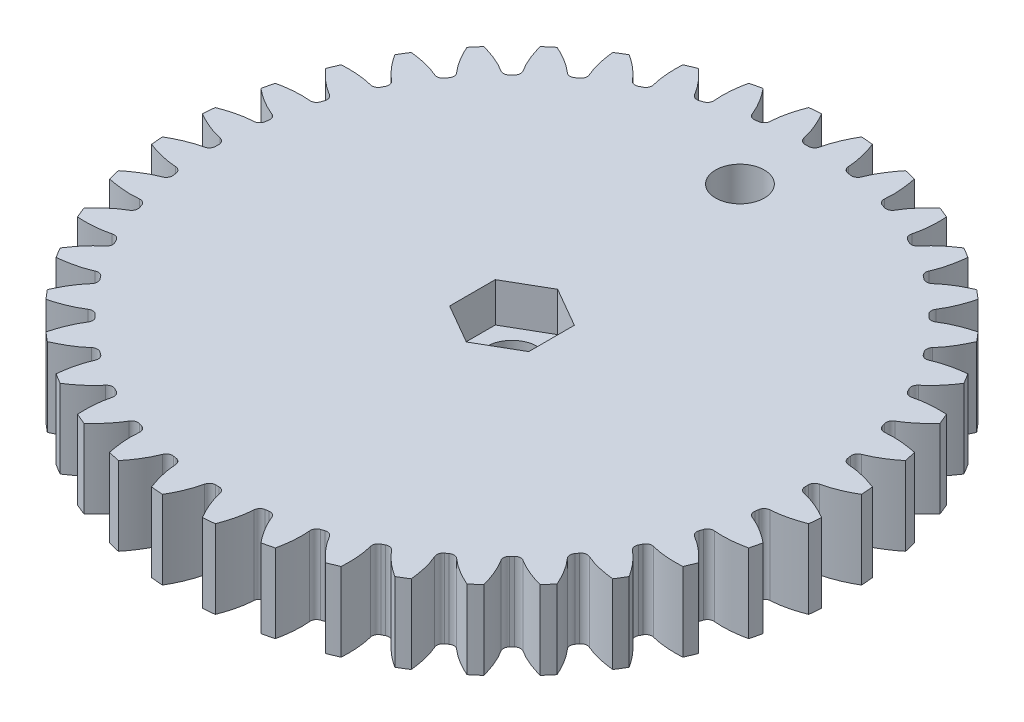
from build123d import *

# Parameters (mm, degrees)
SKETCH2_R                = 53.34
BOSS_EXTRUDE1_DEPTH      = 12.7
CUT_EXTRUDE1_DEPTH       = 12.7
FILLET2_R                = 1.016
CIRPATTERN1_COUNT        = 40
FILLET2_OF_CIRPATTERN1_R = 1.016
SKETCH4_R                = 4.09575
CUT_EXTRUDE2_DEPTH       = 77.359986682
CUT_EXTRUDE3_DEPTH       = 6.35
CUT_EXTRUDE4_DEPTH       = 77.359986682
CUT_EXTRUDE4_DEPTH_BACK  = 77.359986682
SKETCH6_R                = 3.937


with BuildPart() as part:
    # Sketch2 → Boss-Extrude1 (new body)
    with BuildSketch(Plane(origin=(0, 0, 0), x_dir=(1, 0, 0), z_dir=(0, 1, 0))):
        Circle(SKETCH2_R)
    extrude(amount=BOSS_EXTRUDE1_DEPTH)

    # Sketch3 → Cut-Extrude1 (cut)
    with BuildSketch(Plane(origin=(0, 0, 0), x_dir=(-1, 0, 0), z_dir=(0, -1, 0))):
        with BuildLine():
            Line((47.610863724, -1.16029328), (47.722215798, -1.163006969))
            add(Edge.make_bspline(
                [(47.722215798, -1.163006969), (47.730982789, -1.163313167), (47.755564012, -1.16445845), (47.802003051, -1.167754997), (47.87772523, -1.174741096), (47.974119041, -1.186004909), (48.098593622, -1.203276497), (48.245061479, -1.227112329), (48.405834144, -1.256963367), (48.580520514, -1.293386204), (48.754577285, -1.333212779), (48.927987969, -1.376189951), (49.100522746, -1.421931459), (49.30925176, -1.48080125), (49.559155717, -1.556203831), (49.850651678, -1.651349023), (50.180503564, -1.767531099), (50.515821541, -1.894787282), (50.845048793, -2.027276114), (51.176798745, -2.169495413), (51.497150175, -2.313020498), (51.828924093, -2.470658837), (52.134675109, -2.620519189), (52.476090794, -2.797888155), (52.751288045, -2.94379105), (53.034579939, -3.102405155), (53.172312998, -3.180768911), (53.242640535, -3.221308569)],
                knots=[0, 0, 0, 0, 0, 0.005376749, 0.015083688, 0.02853182, 0.04661014, 0.064854849, 0.092110526, 0.119476176, 0.146842496, 0.174208854, 0.201574956, 0.228941013, 0.256307345, 0.307035032, 0.361767352, 0.416499661, 0.471231937, 0.525964282, 0.580696616, 0.635428982, 0.690161387, 0.744893688, 0.799626082, 0.854358407, 0.909090914, 0.909090914, 0.909090914, 0.909090914, 0.909090914], degree=4))
            ThreePointArc((53.242640535, -3.221308569), (53.34, 0), (53.242640535, 3.221308569))
            add(Edge.make_bspline(
                [(53.242640535, 3.221308569), (53.172312998, 3.180768911), (53.034579939, 3.102405155), (52.751288045, 2.94379105), (52.476090794, 2.797888155), (52.134675109, 2.620519189), (51.828924093, 2.470658837), (51.497150175, 2.313020498), (51.176798745, 2.169495413), (50.845048793, 2.027276114), (50.515821541, 1.894787282), (50.180503564, 1.767531099), (49.850651678, 1.651349023), (49.559155717, 1.556203831), (49.30925176, 1.48080125), (49.100522746, 1.421931459), (48.927987969, 1.376189951), (48.754577285, 1.333212779), (48.580520514, 1.293386204), (48.405834144, 1.256963367), (48.245061479, 1.227112329), (48.098593622, 1.203276497), (47.974119041, 1.186004909), (47.87772523, 1.174741096), (47.80200305, 1.167754997), (47.755564012, 1.16445845), (47.730982789, 1.163313167), (47.722215798, 1.163006969)],
                knots=[0.484570751, 0.484570751, 0.484570751, 0.484570751, 0.484570751, 0.539303258, 0.594035583, 0.648767977, 0.703500278, 0.758232683, 0.81296505, 0.867697383, 0.922429728, 0.977162004, 1.031894313, 1.086626633, 1.13735432, 1.164720652, 1.19208671, 1.219452811, 1.246819169, 1.274185489, 1.30155114, 1.328806816, 1.347051526, 1.365129845, 1.378577977, 1.388284917, 1.393661665, 1.393661665, 1.393661665, 1.393661665, 1.393661665], degree=4))
            Line((47.722215798, 1.163006969), (47.610863724, 1.16029328))
            ThreePointArc((47.610863724, 1.16029328), (47.625, 0), (47.610863724, -1.16029328))
        make_face()
    cut_extrude1 = extrude(amount=-CUT_EXTRUDE1_DEPTH, mode=Mode.SUBTRACT)

    # Fillet2
    fillet2_edges = [part.edges().sort_by_distance(p)[0] for p in [
        (-47.610863724, 6.35, -1.16029328),
        (-47.610863724, 6.35, 1.16029328),
    ]]
    fillet(fillet2_edges, radius=FILLET2_R)

    # CirPattern1: Cut-Extrude1 ×40 about axis
    cirpattern1_axis = Axis((0, 12.7, 0), (0, 1, 0))
    for i in range(1, CIRPATTERN1_COUNT):
        add(cut_extrude1.rotate(cirpattern1_axis, i * 360 / CIRPATTERN1_COUNT), mode=Mode.SUBTRACT)

    # Fillet2 of CirPattern1
    fillet2_of_cirpattern1_edges = [part.edges().sort_by_distance(p)[0] for p in [
        (-47.206204844, 6.35, 6.301971852),
        (-46.843185127, 6.35, 8.593988141),
        (-45.639172533, 6.35, 13.609061523),
        (-44.922071849, 6.35, 15.816070492),
        (-42.948352326, 6.35, 20.581050932),
        (-41.894828074, 6.35, 22.648708697),
        (-39.200001148, 6.35, 27.046266564),
        (-37.835994591, 6.35, 28.923660528),
        (-34.486415844, 6.35, 32.845513351),
        (-32.845513351, 6.35, 34.486415844),
        (-28.923660528, 6.35, 37.835994591),
        (-27.046266564, 6.35, 39.200001148),
        (-22.648708697, 6.35, 41.894828074),
        (-20.581050932, 6.35, 42.948352326),
        (-15.816070492, 6.35, 44.922071849),
        (-13.609061523, 6.35, 45.639172533),
        (-8.593988141, 6.35, 46.843185127),
        (-6.301971852, 6.35, 47.206204844),
        (-1.16029328, 6.35, 47.610863724),
        (1.16029328, 6.35, 47.610863724),
        (6.301971852, 6.35, 47.206204844),
        (8.593988141, 6.35, 46.843185127),
        (13.609061523, 6.35, 45.639172533),
        (15.816070492, 6.35, 44.922071849),
        (20.581050932, 6.35, 42.948352326),
        (22.648708697, 6.35, 41.894828074),
        (27.046266564, 6.35, 39.200001148),
        (28.923660528, 6.35, 37.835994591),
        (32.845513351, 6.35, 34.486415844),
        (34.486415844, 6.35, 32.845513351),
        (37.835994591, 6.35, 28.923660528),
        (39.200001148, 6.35, 27.046266564),
        (41.894828074, 6.35, 22.648708697),
        (42.948352326, 6.35, 20.581050932),
        (44.922071849, 6.35, 15.816070492),
        (45.639172533, 6.35, 13.609061523),
        (46.843185127, 6.35, 8.593988141),
        (47.206204844, 6.35, 6.301971852),
        (47.610863724, 6.35, 1.16029328),
        (47.610863724, 6.35, -1.16029328),
        (47.206204844, 6.35, -6.301971852),
        (46.843185127, 6.35, -8.593988141),
        (45.639172533, 6.35, -13.609061523),
        (44.922071849, 6.35, -15.816070492),
        (42.948352326, 6.35, -20.581050932),
        (41.894828074, 6.35, -22.648708697),
        (39.200001148, 6.35, -27.046266564),
        (37.835994591, 6.35, -28.923660528),
        (34.486415844, 6.35, -32.845513351),
        (32.845513351, 6.35, -34.486415844),
        (28.923660528, 6.35, -37.835994591),
        (27.046266564, 6.35, -39.200001148),
        (22.648708697, 6.35, -41.894828074),
        (20.581050932, 6.35, -42.948352326),
        (15.816070492, 6.35, -44.922071849),
        (13.609061523, 6.35, -45.639172533),
        (8.593988141, 6.35, -46.843185127),
        (6.301971852, 6.35, -47.206204844),
        (1.16029328, 6.35, -47.610863724),
        (-1.16029328, 6.35, -47.610863724),
        (-6.301971852, 6.35, -47.206204844),
        (-8.593988141, 6.35, -46.843185127),
        (-13.609061523, 6.35, -45.639172533),
        (-15.816070492, 6.35, -44.922071849),
        (-20.581050932, 6.35, -42.948352326),
        (-22.648708697, 6.35, -41.894828074),
        (-27.046266564, 6.35, -39.200001148),
        (-28.923660528, 6.35, -37.835994591),
        (-32.845513351, 6.35, -34.486415844),
        (-34.486415844, 6.35, -32.845513351),
        (-37.835994591, 6.35, -28.923660528),
        (-39.200001148, 6.35, -27.046266564),
        (-41.894828074, 6.35, -22.648708697),
        (-42.948352326, 6.35, -20.581050932),
        (-44.922071849, 6.35, -15.816070492),
        (-45.639172533, 6.35, -13.609061523),
        (-46.843185127, 6.35, -8.593988141),
        (-47.206204844, 6.35, -6.301971852),
    ]]
    fillet(fillet2_of_cirpattern1_edges, radius=FILLET2_OF_CIRPATTERN1_R)

    # Sketch4 → Cut-Extrude2 (cut, through all)
    with BuildSketch(Plane(origin=(0, 12.7, 0), x_dir=(1, 0, 0), z_dir=(0, 1, 0))):
        Circle(SKETCH4_R)
    extrude(amount=-CUT_EXTRUDE2_DEPTH, mode=Mode.SUBTRACT)

    # Sketch5 → Cut-Extrude3 (cut)
    with BuildSketch(Plane(origin=(0, 12.7, 0), x_dir=(1, 0, 0), z_dir=(0, 1, 0))):
        Polygon((0, 7.376342509), (-6.3881, 3.688171255), (-6.3881, -3.688171255), (0, -7.376342509), (6.3881, -3.688171255), (6.3881, 3.688171255), align=None)
    extrude(amount=-CUT_EXTRUDE3_DEPTH, mode=Mode.SUBTRACT)

    # Sketch6 → Cut-Extrude4 (cut, two sides: drawn at the far end of the back side and taken through both)
    with BuildSketch(Plane(origin=(0, 12.7, 0), x_dir=(1, 0, 0), z_dir=(0, 1, 0)).offset(-CUT_EXTRUDE4_DEPTH_BACK)):
        with Locations((0, 36.83)):
            Circle(SKETCH6_R)
    extrude(amount=CUT_EXTRUDE4_DEPTH + CUT_EXTRUDE4_DEPTH_BACK, mode=Mode.SUBTRACT)


solid = part.part
